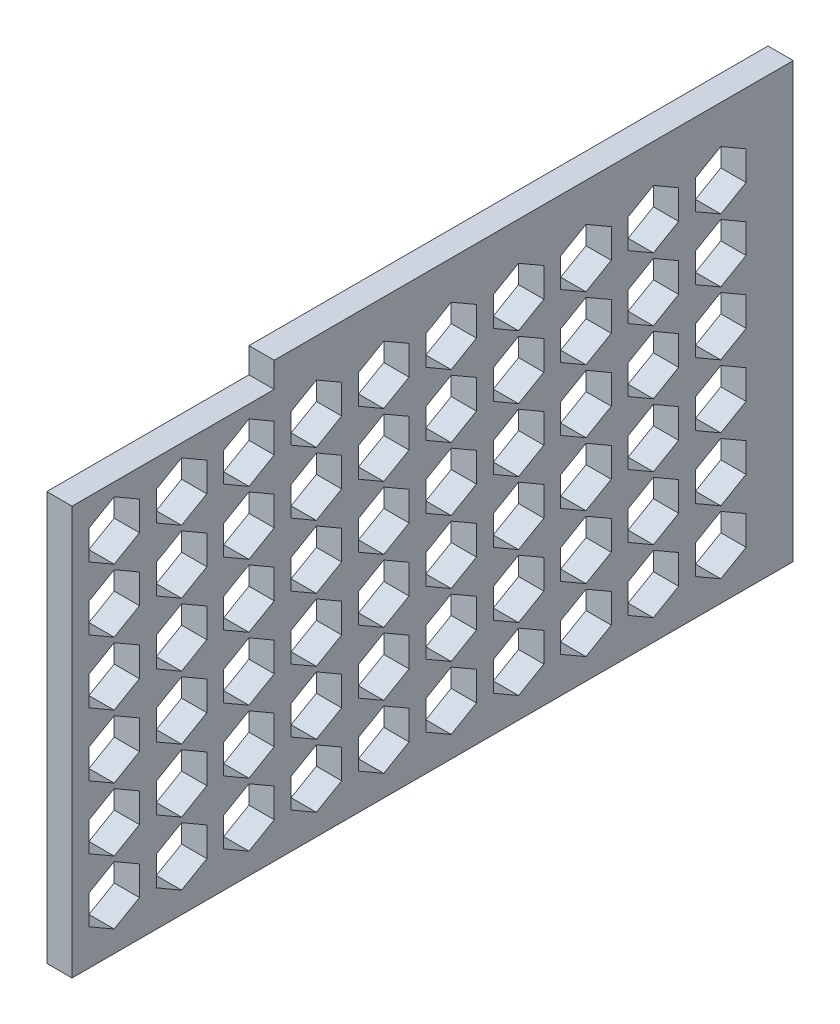
from build123d import *

# Parameters (mm, degrees)
EXTRUDE_1_DEPTH                = 3
CUT_EXTRUDE_1_DEPTH            = 3
PATTERN_LINEAR_1_COUNT         = 5
PATTERN_LINEAR_1_PITCH         = 16
PATTERN_LINEAR_2_COUNT         = 6
PATTERN_LINEAR_2_PITCH         = 7.5
PATTERN_LINEAR_2_COPY_1_DEPTH  = 3
PATTERN_LINEAR_2_COPY_2_DEPTH  = 3
PATTERN_LINEAR_2_COPY_3_DEPTH  = 3
PATTERN_LINEAR_2_COPY_4_DEPTH  = 3
PATTERN_LINEAR_2_COPY_5_DEPTH  = 3
PATTERN_LINEAR_2_COPY_6_DEPTH  = 3
PATTERN_LINEAR_2_COPY_7_DEPTH  = 3
PATTERN_LINEAR_2_COPY_8_DEPTH  = 3
PATTERN_LINEAR_2_COPY_9_DEPTH  = 3
PATTERN_LINEAR_2_COPY_10_DEPTH = 3
PATTERN_LINEAR_2_COPY_11_DEPTH = 3
PATTERN_LINEAR_2_COPY_12_DEPTH = 3
PATTERN_LINEAR_2_COPY_13_DEPTH = 3
PATTERN_LINEAR_2_COPY_14_DEPTH = 3
PATTERN_LINEAR_2_COPY_15_DEPTH = 3
PATTERN_LINEAR_2_COPY_16_DEPTH = 3
PATTERN_LINEAR_2_COPY_17_DEPTH = 3
PATTERN_LINEAR_2_COPY_18_DEPTH = 3
PATTERN_LINEAR_2_COPY_19_DEPTH = 3
PATTERN_LINEAR_2_COPY_20_DEPTH = 3


with BuildPart() as part:
    # 草图1 → 凸台-拉伸1 (new body)
    with BuildSketch(Plane(origin=(0, 0, 0), x_dir=(0, 0, -1), z_dir=(1, 0, 0))):
        Polygon((0, 0), (24, 0), (24, 3), (85.6, 3), (85.6, -48.5), (0, -48.5), align=None)
    extrude(amount=EXTRUDE_1_DEPTH)

    # 草图2 → 切除-拉伸1 (cut)
    with BuildSketch(Plane(origin=(3, 0, 0), x_dir=(0, 0, -1), z_dir=(1, 0, 0))):
        Polygon((2, -3.267949192), (2, -6.732050808), (5, -8.464101615), (8, -6.732050808), (8, -3.267949192), (5, -1.535898385), align=None)
        Polygon((10, -3.267949192), (10, -6.732050808), (13, -8.464101615), (16, -6.732050808), (16, -3.267949192), (13, -1.535898385), align=None)
    cut_extrude_1 = extrude(amount=-CUT_EXTRUDE_1_DEPTH, mode=Mode.SUBTRACT)

    # 阵列(线性)1: 切除-拉伸1 ×5
    with Locations(*[(0, 0, -i * PATTERN_LINEAR_1_PITCH) for i in range(1, PATTERN_LINEAR_1_COUNT)]):
        add(cut_extrude_1, mode=Mode.SUBTRACT)

    # 阵列(线性)2: 切除-拉伸1 ×6
    with Locations(*[(0, -i * PATTERN_LINEAR_2_PITCH, 0) for i in range(1, PATTERN_LINEAR_2_COUNT)]):
        add(cut_extrude_1, mode=Mode.SUBTRACT)

    # 阵列(线性)2 copy 1 sketch → 阵列(线性)2 copy 1 (cut)
    with BuildSketch(Plane(origin=(3, -7.5, -16), x_dir=(0, 0, -1), z_dir=(1, 0, 0))):
        Polygon((2, -3.267949192), (2, -6.732050808), (5, -8.464101615), (8, -6.732050808), (8, -3.267949192), (5, -1.535898385), align=None)
        Polygon((10, -3.267949192), (10, -6.732050808), (13, -8.464101615), (16, -6.732050808), (16, -3.267949192), (13, -1.535898385), align=None)
    extrude(amount=-PATTERN_LINEAR_2_COPY_1_DEPTH, mode=Mode.SUBTRACT)

    # 阵列(线性)2 copy 2 sketch → 阵列(线性)2 copy 2 (cut)
    with BuildSketch(Plane(origin=(3, -15, -16), x_dir=(0, 0, -1), z_dir=(1, 0, 0))):
        Polygon((2, -3.267949192), (2, -6.732050808), (5, -8.464101615), (8, -6.732050808), (8, -3.267949192), (5, -1.535898385), align=None)
        Polygon((10, -3.267949192), (10, -6.732050808), (13, -8.464101615), (16, -6.732050808), (16, -3.267949192), (13, -1.535898385), align=None)
    extrude(amount=-PATTERN_LINEAR_2_COPY_2_DEPTH, mode=Mode.SUBTRACT)

    # 阵列(线性)2 copy 3 sketch → 阵列(线性)2 copy 3 (cut)
    with BuildSketch(Plane(origin=(3, -22.5, -16), x_dir=(0, 0, -1), z_dir=(1, 0, 0))):
        Polygon((2, -3.267949192), (2, -6.732050808), (5, -8.464101615), (8, -6.732050808), (8, -3.267949192), (5, -1.535898385), align=None)
        Polygon((10, -3.267949192), (10, -6.732050808), (13, -8.464101615), (16, -6.732050808), (16, -3.267949192), (13, -1.535898385), align=None)
    extrude(amount=-PATTERN_LINEAR_2_COPY_3_DEPTH, mode=Mode.SUBTRACT)

    # 阵列(线性)2 copy 4 sketch → 阵列(线性)2 copy 4 (cut)
    with BuildSketch(Plane(origin=(3, -30, -16), x_dir=(0, 0, -1), z_dir=(1, 0, 0))):
        Polygon((2, -3.267949192), (2, -6.732050808), (5, -8.464101615), (8, -6.732050808), (8, -3.267949192), (5, -1.535898385), align=None)
        Polygon((10, -3.267949192), (10, -6.732050808), (13, -8.464101615), (16, -6.732050808), (16, -3.267949192), (13, -1.535898385), align=None)
    extrude(amount=-PATTERN_LINEAR_2_COPY_4_DEPTH, mode=Mode.SUBTRACT)

    # 阵列(线性)2 copy 5 sketch → 阵列(线性)2 copy 5 (cut)
    with BuildSketch(Plane(origin=(3, -37.5, -16), x_dir=(0, 0, -1), z_dir=(1, 0, 0))):
        Polygon((2, -3.267949192), (2, -6.732050808), (5, -8.464101615), (8, -6.732050808), (8, -3.267949192), (5, -1.535898385), align=None)
        Polygon((10, -3.267949192), (10, -6.732050808), (13, -8.464101615), (16, -6.732050808), (16, -3.267949192), (13, -1.535898385), align=None)
    extrude(amount=-PATTERN_LINEAR_2_COPY_5_DEPTH, mode=Mode.SUBTRACT)

    # 阵列(线性)2 copy 6 sketch → 阵列(线性)2 copy 6 (cut)
    with BuildSketch(Plane(origin=(3, -7.5, -32), x_dir=(0, 0, -1), z_dir=(1, 0, 0))):
        Polygon((2, -3.267949192), (2, -6.732050808), (5, -8.464101615), (8, -6.732050808), (8, -3.267949192), (5, -1.535898385), align=None)
        Polygon((10, -3.267949192), (10, -6.732050808), (13, -8.464101615), (16, -6.732050808), (16, -3.267949192), (13, -1.535898385), align=None)
    extrude(amount=-PATTERN_LINEAR_2_COPY_6_DEPTH, mode=Mode.SUBTRACT)

    # 阵列(线性)2 copy 7 sketch → 阵列(线性)2 copy 7 (cut)
    with BuildSketch(Plane(origin=(3, -15, -32), x_dir=(0, 0, -1), z_dir=(1, 0, 0))):
        Polygon((2, -3.267949192), (2, -6.732050808), (5, -8.464101615), (8, -6.732050808), (8, -3.267949192), (5, -1.535898385), align=None)
        Polygon((10, -3.267949192), (10, -6.732050808), (13, -8.464101615), (16, -6.732050808), (16, -3.267949192), (13, -1.535898385), align=None)
    extrude(amount=-PATTERN_LINEAR_2_COPY_7_DEPTH, mode=Mode.SUBTRACT)

    # 阵列(线性)2 copy 8 sketch → 阵列(线性)2 copy 8 (cut)
    with BuildSketch(Plane(origin=(3, -22.5, -32), x_dir=(0, 0, -1), z_dir=(1, 0, 0))):
        Polygon((2, -3.267949192), (2, -6.732050808), (5, -8.464101615), (8, -6.732050808), (8, -3.267949192), (5, -1.535898385), align=None)
        Polygon((10, -3.267949192), (10, -6.732050808), (13, -8.464101615), (16, -6.732050808), (16, -3.267949192), (13, -1.535898385), align=None)
    extrude(amount=-PATTERN_LINEAR_2_COPY_8_DEPTH, mode=Mode.SUBTRACT)

    # 阵列(线性)2 copy 9 sketch → 阵列(线性)2 copy 9 (cut)
    with BuildSketch(Plane(origin=(3, -30, -32), x_dir=(0, 0, -1), z_dir=(1, 0, 0))):
        Polygon((2, -3.267949192), (2, -6.732050808), (5, -8.464101615), (8, -6.732050808), (8, -3.267949192), (5, -1.535898385), align=None)
        Polygon((10, -3.267949192), (10, -6.732050808), (13, -8.464101615), (16, -6.732050808), (16, -3.267949192), (13, -1.535898385), align=None)
    extrude(amount=-PATTERN_LINEAR_2_COPY_9_DEPTH, mode=Mode.SUBTRACT)

    # 阵列(线性)2 copy 10 sketch → 阵列(线性)2 copy 10 (cut)
    with BuildSketch(Plane(origin=(3, -37.5, -32), x_dir=(0, 0, -1), z_dir=(1, 0, 0))):
        Polygon((2, -3.267949192), (2, -6.732050808), (5, -8.464101615), (8, -6.732050808), (8, -3.267949192), (5, -1.535898385), align=None)
        Polygon((10, -3.267949192), (10, -6.732050808), (13, -8.464101615), (16, -6.732050808), (16, -3.267949192), (13, -1.535898385), align=None)
    extrude(amount=-PATTERN_LINEAR_2_COPY_10_DEPTH, mode=Mode.SUBTRACT)

    # 阵列(线性)2 copy 11 sketch → 阵列(线性)2 copy 11 (cut)
    with BuildSketch(Plane(origin=(3, -7.5, -48), x_dir=(0, 0, -1), z_dir=(1, 0, 0))):
        Polygon((2, -3.267949192), (2, -6.732050808), (5, -8.464101615), (8, -6.732050808), (8, -3.267949192), (5, -1.535898385), align=None)
        Polygon((10, -3.267949192), (10, -6.732050808), (13, -8.464101615), (16, -6.732050808), (16, -3.267949192), (13, -1.535898385), align=None)
    extrude(amount=-PATTERN_LINEAR_2_COPY_11_DEPTH, mode=Mode.SUBTRACT)

    # 阵列(线性)2 copy 12 sketch → 阵列(线性)2 copy 12 (cut)
    with BuildSketch(Plane(origin=(3, -15, -48), x_dir=(0, 0, -1), z_dir=(1, 0, 0))):
        Polygon((2, -3.267949192), (2, -6.732050808), (5, -8.464101615), (8, -6.732050808), (8, -3.267949192), (5, -1.535898385), align=None)
        Polygon((10, -3.267949192), (10, -6.732050808), (13, -8.464101615), (16, -6.732050808), (16, -3.267949192), (13, -1.535898385), align=None)
    extrude(amount=-PATTERN_LINEAR_2_COPY_12_DEPTH, mode=Mode.SUBTRACT)

    # 阵列(线性)2 copy 13 sketch → 阵列(线性)2 copy 13 (cut)
    with BuildSketch(Plane(origin=(3, -22.5, -48), x_dir=(0, 0, -1), z_dir=(1, 0, 0))):
        Polygon((2, -3.267949192), (2, -6.732050808), (5, -8.464101615), (8, -6.732050808), (8, -3.267949192), (5, -1.535898385), align=None)
        Polygon((10, -3.267949192), (10, -6.732050808), (13, -8.464101615), (16, -6.732050808), (16, -3.267949192), (13, -1.535898385), align=None)
    extrude(amount=-PATTERN_LINEAR_2_COPY_13_DEPTH, mode=Mode.SUBTRACT)

    # 阵列(线性)2 copy 14 sketch → 阵列(线性)2 copy 14 (cut)
    with BuildSketch(Plane(origin=(3, -30, -48), x_dir=(0, 0, -1), z_dir=(1, 0, 0))):
        Polygon((2, -3.267949192), (2, -6.732050808), (5, -8.464101615), (8, -6.732050808), (8, -3.267949192), (5, -1.535898385), align=None)
        Polygon((10, -3.267949192), (10, -6.732050808), (13, -8.464101615), (16, -6.732050808), (16, -3.267949192), (13, -1.535898385), align=None)
    extrude(amount=-PATTERN_LINEAR_2_COPY_14_DEPTH, mode=Mode.SUBTRACT)

    # 阵列(线性)2 copy 15 sketch → 阵列(线性)2 copy 15 (cut)
    with BuildSketch(Plane(origin=(3, -37.5, -48), x_dir=(0, 0, -1), z_dir=(1, 0, 0))):
        Polygon((2, -3.267949192), (2, -6.732050808), (5, -8.464101615), (8, -6.732050808), (8, -3.267949192), (5, -1.535898385), align=None)
        Polygon((10, -3.267949192), (10, -6.732050808), (13, -8.464101615), (16, -6.732050808), (16, -3.267949192), (13, -1.535898385), align=None)
    extrude(amount=-PATTERN_LINEAR_2_COPY_15_DEPTH, mode=Mode.SUBTRACT)

    # 阵列(线性)2 copy 16 sketch → 阵列(线性)2 copy 16 (cut)
    with BuildSketch(Plane(origin=(3, -7.5, -64), x_dir=(0, 0, -1), z_dir=(1, 0, 0))):
        Polygon((2, -3.267949192), (2, -6.732050808), (5, -8.464101615), (8, -6.732050808), (8, -3.267949192), (5, -1.535898385), align=None)
        Polygon((10, -3.267949192), (10, -6.732050808), (13, -8.464101615), (16, -6.732050808), (16, -3.267949192), (13, -1.535898385), align=None)
    extrude(amount=-PATTERN_LINEAR_2_COPY_16_DEPTH, mode=Mode.SUBTRACT)

    # 阵列(线性)2 copy 17 sketch → 阵列(线性)2 copy 17 (cut)
    with BuildSketch(Plane(origin=(3, -15, -64), x_dir=(0, 0, -1), z_dir=(1, 0, 0))):
        Polygon((2, -3.267949192), (2, -6.732050808), (5, -8.464101615), (8, -6.732050808), (8, -3.267949192), (5, -1.535898385), align=None)
        Polygon((10, -3.267949192), (10, -6.732050808), (13, -8.464101615), (16, -6.732050808), (16, -3.267949192), (13, -1.535898385), align=None)
    extrude(amount=-PATTERN_LINEAR_2_COPY_17_DEPTH, mode=Mode.SUBTRACT)

    # 阵列(线性)2 copy 18 sketch → 阵列(线性)2 copy 18 (cut)
    with BuildSketch(Plane(origin=(3, -22.5, -64), x_dir=(0, 0, -1), z_dir=(1, 0, 0))):
        Polygon((2, -3.267949192), (2, -6.732050808), (5, -8.464101615), (8, -6.732050808), (8, -3.267949192), (5, -1.535898385), align=None)
        Polygon((10, -3.267949192), (10, -6.732050808), (13, -8.464101615), (16, -6.732050808), (16, -3.267949192), (13, -1.535898385), align=None)
    extrude(amount=-PATTERN_LINEAR_2_COPY_18_DEPTH, mode=Mode.SUBTRACT)

    # 阵列(线性)2 copy 19 sketch → 阵列(线性)2 copy 19 (cut)
    with BuildSketch(Plane(origin=(3, -30, -64), x_dir=(0, 0, -1), z_dir=(1, 0, 0))):
        Polygon((2, -3.267949192), (2, -6.732050808), (5, -8.464101615), (8, -6.732050808), (8, -3.267949192), (5, -1.535898385), align=None)
        Polygon((10, -3.267949192), (10, -6.732050808), (13, -8.464101615), (16, -6.732050808), (16, -3.267949192), (13, -1.535898385), align=None)
    extrude(amount=-PATTERN_LINEAR_2_COPY_19_DEPTH, mode=Mode.SUBTRACT)

    # 阵列(线性)2 copy 20 sketch → 阵列(线性)2 copy 20 (cut)
    with BuildSketch(Plane(origin=(3, -37.5, -64), x_dir=(0, 0, -1), z_dir=(1, 0, 0))):
        Polygon((2, -3.267949192), (2, -6.732050808), (5, -8.464101615), (8, -6.732050808), (8, -3.267949192), (5, -1.535898385), align=None)
        Polygon((10, -3.267949192), (10, -6.732050808), (13, -8.464101615), (16, -6.732050808), (16, -3.267949192), (13, -1.535898385), align=None)
    extrude(amount=-PATTERN_LINEAR_2_COPY_20_DEPTH, mode=Mode.SUBTRACT)


solid = part.part
